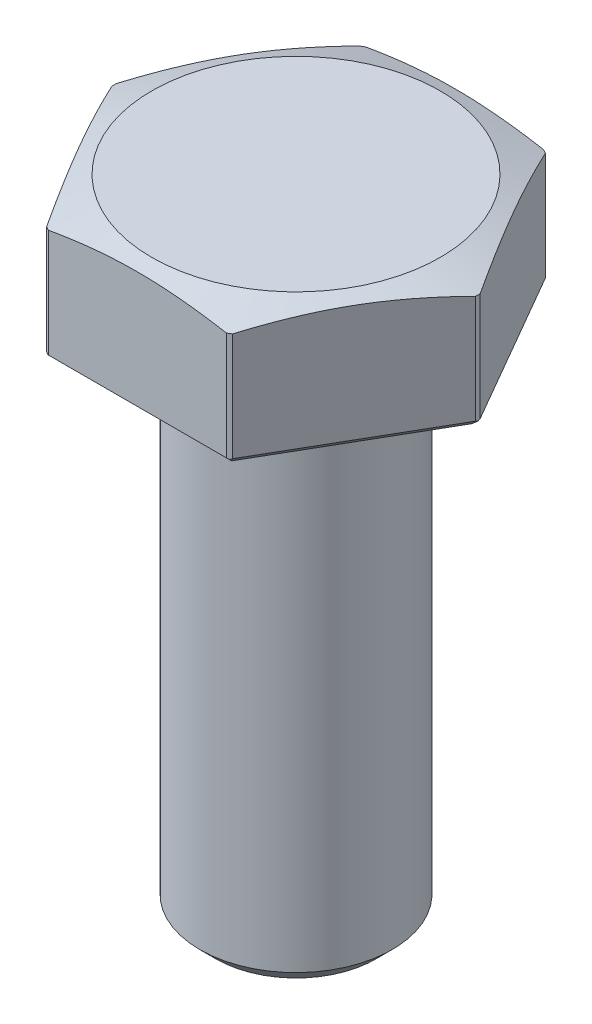
from build123d import *

# Parameters (mm, degrees)
SKETCH2_OUTSIDE_W  = 18.472
SKETCH2_OUTSIDE_H  = 18.472
CUT_EXTRUDE1_DEPTH = 19.95
CHAMFER1_SIZE      = 0.2


with BuildPart() as part:
    # Sketch1 → Revolve1 (revolve)
    with BuildSketch(Plane(origin=(0, 0, 0), x_dir=(0, 0, -1), z_dir=(1, 0, 0)), mode=Mode.PRIVATE) as revolve1_sk:
        with BuildLine():
            Line((0, 4), (4.5, 4))
            Line((4.5, 4), (5.675, 3.572334975))
            Line((5.675, 3.572334975), (5.675, 0))
            Line((5.675, 0), (4.75, 0))
            Line((4.75, 0), (4.4, -0.15))
            Line((4.4, -0.15), (3, -0.15))
            ThreePointArc((3, -0.15), (2.93268544, -0.1629636), (2.875, -0.2))
            Line((2.875, -0.2), (2.75, -0.2))
            Line((2.75, -0.2), (2.75, -0.65))
            Line((2.75, -0.65), (3, -0.9))
            Line((3, -0.9), (3, -15.45))
            Line((3, -15.45), (2.5, -15.95))
            Line((2.5, -15.95), (0, -15.95))
            Line((0, -15.95), (0, 4))
        make_face()
    revolve(revolve1_sk.sketch.rotate(Axis((0, 15.969730791, 0), (0, -1, 0)), 180), axis=Axis((0, 15.969730791, 0), (0, -1, 0)))

    # Sketch2 outside → Cut-Extrude1 (cut)
    with BuildSketch(Plane(origin=(0, 4, 0), x_dir=(1, 0, 0), z_dir=(0, 1, 0))):
        Rectangle(SKETCH2_OUTSIDE_W, SKETCH2_OUTSIDE_H)
        Polygon((2.857883832, -4.95), (5.715767665, 0), (2.857883832, 4.95), (-2.857883832, 4.95), (-5.715767665, 0), (-2.857883832, -4.95), align=None, mode=Mode.SUBTRACT)
    extrude(amount=-CUT_EXTRUDE1_DEPTH, mode=Mode.SUBTRACT)

    # Chamfer1
    # the kernel refuses this chamfer: 0.2 mm, written as the material it takes off along each edge
    with BuildSketch(Plane(origin=(-2.641932243, 0, 5.324039125), x_dir=(-0.023812127644090332, 0.9996219169112968, 0.01374793830529327), z_dir=(-0.4999999999999996, 0, -0.8660254037844389)), Plane(origin=(3.289787011, 0, 4.95), x_dir=(0, 0.9996219169112966, 0.027495876610587326), z_dir=(-1, 0, 0)), Plane(origin=(5.931719254, 0, -0.374039125), x_dir=(0.023812127644088587, 0.9996219169112968, 0.013747938305292286), z_dir=(-0.5000000000000003, 0, 0.8660254037844386)), Plane(origin=(-5.931719254, 0, 0.374039125), x_dir=(-0.023812127644091206, 0.9996219169112966, -0.013747938305293793), z_dir=(0.5000000000000002, 0, -0.8660254037844386)), Plane(origin=(-3.289787011, 0, -4.95), x_dir=(0, 0.9996219169112966, -0.027495876610587326), z_dir=(1, 0, 0)), Plane(origin=(2.641932243, 0, -5.324039125), x_dir=(0.02381212764409033, 0.9996219169112968, -0.013747938305293275), z_dir=(0.49999999999999994, 0, 0.8660254037844388))) as chamfer1_piece_1:
        Polygon((CHAMFER1_SIZE * 0.999621916911, CHAMFER1_SIZE * 0.0274958766106), (-CHAMFER1_SIZE * 0.0274958766106, CHAMFER1_SIZE * 0.999621916911), (0, 0), align=None)
    extrude(amount=6.579574023, mode=Mode.SUBTRACT)


solid = part.part
